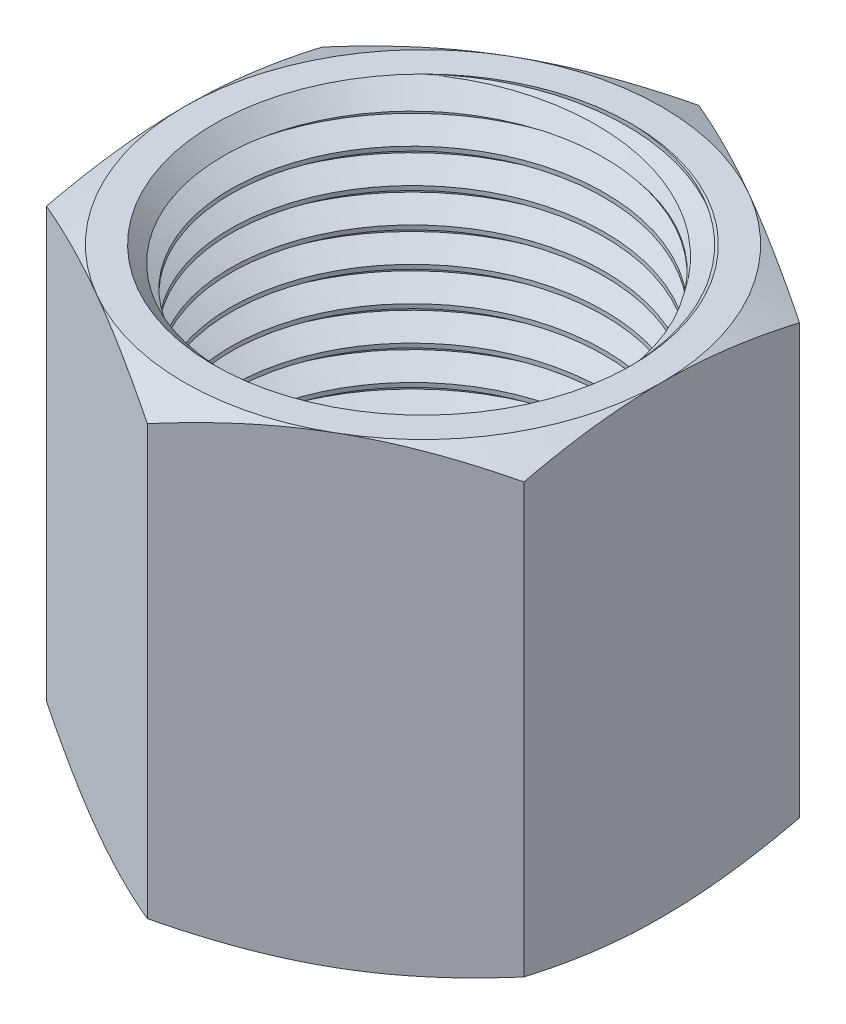
from build123d import *

# Parameters (mm, degrees)
EXTRUDE1_DEPTH   = 24.638
SKETCH2_W        = 11.1125
SKETCH2_H        = 24.638
CUT_SWEEP1_PITCH = 1.814285714
SKETCH7_W        = 11.1125
SKETCH7_H        = 4.106333333
SKETCH8_W        = 8.89
SKETCH8_H        = 4.106333333


with BuildPart() as part:
    # Sketch1 → Extrude1 (new body)
    with BuildSketch(Plane(origin=(0, 0, 0), x_dir=(1, 0, 0), z_dir=(0, 1, 0))):
        Polygon((0, 14.664696837), (-12.7, 7.332348419), (-12.7, -7.332348419), (0, -14.664696837), (12.7, -7.332348419), (12.7, 7.332348419), align=None)
    extrude(amount=EXTRUDE1_DEPTH)


with BuildPart() as body_2:
    # Sketch2 → Revolve1 (revolve)
    with BuildSketch(Plane(origin=(0, 0, 0), x_dir=(0, 0, -1), z_dir=(1, 0, 0))):
        with Locations((5.55625, 12.319)):
            Rectangle(SKETCH2_W, SKETCH2_H)
    revolve(axis=Axis((0, -11.1125, 0), (0, 1, 0)))

    # Cut-Sweep1: the profile of Sketch10 profile screwed along a right-hand helix of 18.188976 turns, 10 arcs to a turn; built about Z, then put on its axis
    cut_sweep1_z = Axis((0, 0, 0), (0, 0, 1))
    cut_sweep1_corners = [(11.1128, 0, -1.587673205), (11.1128, 0, 0.000173205), (9.934086861, 0, -0.680357143), (9.934086861, 0, -0.907142857)]
    with BuildLine(mode=Mode.PRIVATE) as cut_sweep1_profile:
        Line(cut_sweep1_corners[0], cut_sweep1_corners[1])
        Line(cut_sweep1_corners[1], cut_sweep1_corners[2])
        Line(cut_sweep1_corners[2], cut_sweep1_corners[3])
        Line(cut_sweep1_corners[3], cut_sweep1_corners[0])
    cut_sweep1_cap = Face(cut_sweep1_profile.wire())
    cut_sweep1_turn_angles = [0, 18, 36, 54, 72, 90, 108, 126, 144, 162, 180, 198, 216, 234, 252, 270, 288, 306, 324, 342, 360]
    cut_sweep1_turn_weights = [1, 0.9510565162951535, 1, 0.9510565162951535, 1, 0.9510565162951535, 1, 0.9510565162951535, 1, 0.9510565162951535, 1, 0.9510565162951535, 1, 0.9510565162951535, 1, 0.9510565162951535, 1, 0.9510565162951535, 1, 0.9510565162951535, 1]
    cut_sweep1_turn_rails = [Edge.make_bspline([Vector(p[0], p[1], 0).rotate(cut_sweep1_z, cut_sweep1_turn_angles[k]) / cut_sweep1_turn_weights[k] + Vector(0, 0, p[2] + CUT_SWEEP1_PITCH * cut_sweep1_turn_angles[k] / 360) for k in range(21)], [0, 0, 0, 1, 1, 2, 2, 3, 3, 4, 4, 5, 5, 6, 6, 7, 7, 8, 8, 9, 9, 10, 10, 10], 2, cut_sweep1_turn_weights) for p in cut_sweep1_corners]
    cut_sweep1_turn_sides = [Face.make_surface_from_curves(cut_sweep1_turn_rails[p[0]], cut_sweep1_turn_rails[p[1]]) for p in [(0, 1), (1, 2), (2, 3), (3, 0)]]
    cut_sweep1_last_angles = [6480, 6498, 6516, 6532.015748031, 6548.031496063]
    cut_sweep1_last_weights = [1, 0.9510565162951535, 1, 0.961185899324416, 1]
    cut_sweep1_last_rails = [Edge.make_bspline([Vector(p[0], p[1], 0).rotate(cut_sweep1_z, cut_sweep1_last_angles[k]) / cut_sweep1_last_weights[k] + Vector(0, 0, p[2] + CUT_SWEEP1_PITCH * cut_sweep1_last_angles[k] / 360) for k in range(5)], [0, 0, 0, 1, 1, 2, 2, 2], 2, cut_sweep1_last_weights) for p in cut_sweep1_corners]
    cut_sweep1_last_sides = [Face.make_surface_from_curves(cut_sweep1_last_rails[p[0]], cut_sweep1_last_rails[p[1]]) for p in [(0, 1), (1, 2), (2, 3), (3, 0)]]
    cut_sweep1 = Plane(origin=(0, 24.638, 0), x_dir=(0, 0, -1), z_dir=(0, -1, 0)) * Solid(Shell([*[p.moved(Location((0, 0, CUT_SWEEP1_PITCH * i))) for i in range(18) for p in cut_sweep1_turn_sides], *cut_sweep1_last_sides, cut_sweep1_cap, cut_sweep1_cap.rotate(cut_sweep1_z, 6548.031496063).moved(Location((0, 0, CUT_SWEEP1_PITCH * 6548.031496063 / 360)))]))
    add(cut_sweep1, mode=Mode.SUBTRACT)


with BuildPart() as part_1:
    add(part.part)

    # Combine1: cut body 2
    add(body_2.part, mode=Mode.SUBTRACT)

    # Cut-Extrude1 cone 1 section (through the dimple's axis) → Cut-Extrude1 (revolve, cut)
    with BuildSketch(Plane(origin=(0, 24.638, 0), x_dir=(0, 0, 1), z_dir=(1, 0, 0))):
        Polygon((0, 0), (11.1125, 0), (0, 11.1125), align=None)
    revolve(axis=Axis((0, 24.638, 0), (0, -1, 0)), mode=Mode.SUBTRACT)

    # Sketch5 → Cut-Revolve3 (revolve, cut)
    with BuildSketch(Plane(origin=(0, 0, 0), x_dir=(0, 0, -1), z_dir=(1, 0, 0))):
        Polygon((0, 0), (12.7, 0), (14.664696837, 0.916153181), (14.664696837, 23.721846819), (12.7, 24.638), (0, 24.638), (0, 25.908), (15.934696837, 25.908), (15.934696837, -1.27), (0, -1.27), align=None)
    revolve(axis=Axis((0, 0, 0), (0, 1, 0)), mode=Mode.SUBTRACT)

    # Sketch7 → Revolve2 (revolve)
    with BuildSketch(Plane(origin=(0, 0, 0), x_dir=(0, 0, -1), z_dir=(1, 0, 0))):
        with Locations((5.55625, 2.053166667)):
            Rectangle(SKETCH7_W, SKETCH7_H)
    revolve(axis=Axis((0, 0, 0), (0, 1, 0)))

    # Sketch8 → Cut-Revolve4 (revolve, cut)
    with BuildSketch(Plane(origin=(0, 0, 0), x_dir=(0, 0, -1), z_dir=(1, 0, 0))):
        with Locations((4.445, 2.053166667)):
            Rectangle(SKETCH8_W, SKETCH8_H)
    revolve(axis=Axis((0, 0, 0), (0, 1, 0)), mode=Mode.SUBTRACT)


solid = part_1.part
